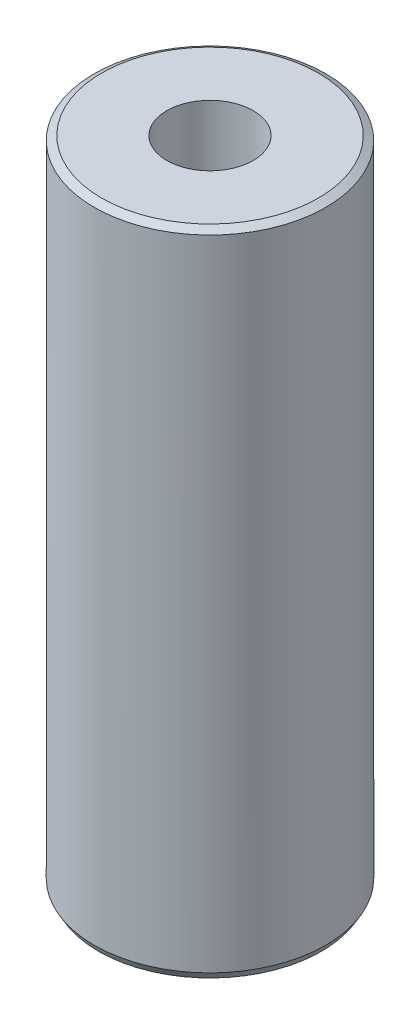
from build123d import *
from OCP.BRepFilletAPI import BRepFilletAPI_MakeChamfer

# Parameters (mm, degrees)
SKETCH1_R           = 37.5
BOSS_EXTRUDE1_DEPTH = 210.754686584
SKETCH2_R           = 13.996310457
CUT_EXTRUDE1_DEPTH  = 218.324729189
CHAMFER1_SIZE       = 1.392192765
CHAMFER1_SIZE2      = 2.411348603


with BuildPart() as part:
    # Sketch1 → Boss-Extrude1 (new body)
    with BuildSketch(Plane(origin=(0, 0, 0), x_dir=(1, 0, 0), z_dir=(0, 1, 0))):
        Circle(SKETCH1_R)
    extrude(amount=BOSS_EXTRUDE1_DEPTH)

    # Sketch2 → Cut-Extrude1 (cut, through all)
    with BuildSketch(Plane(origin=(0, 0, 0), x_dir=(1, 0, 0), z_dir=(0, 1, 0))):
        Circle(SKETCH2_R)
    extrude(amount=CUT_EXTRUDE1_DEPTH, mode=Mode.SUBTRACT)

    # Chamfer1: one chamfer whose edges measure the first distance from different faces: ONE call of the kernel's chamfer builder (chamfer() names one face for all edges)
    chamfer1_edges_1 = [part.edges().sort_by_distance(p)[0] for p in [
        (-37.5, 210.754686584, 0),
    ]]
    chamfer1_side_1 = [part.faces().sort_by_distance(p)[0] for p in [
        (-37.5, 105.377343292, 0),
    ]]
    chamfer1_edges_2 = [part.edges().sort_by_distance(p)[0] for p in [
        (-37.5, 0, 0),
    ]]
    chamfer1_side_2 = [part.faces().sort_by_distance(p)[0] for p in [
        (-36.439339828, 0, 0),
    ]]
    chamfer1 = BRepFilletAPI_MakeChamfer(part.part.solid().wrapped)
    for e in chamfer1_edges_1:
        chamfer1.Add(CHAMFER1_SIZE, CHAMFER1_SIZE2, e.wrapped, chamfer1_side_1[0].wrapped)  # the first distance lies on this face
    for e in chamfer1_edges_2:
        chamfer1.Add(CHAMFER1_SIZE, CHAMFER1_SIZE2, e.wrapped, chamfer1_side_2[0].wrapped)  # the first distance lies on this face
    add(Compound.cast(chamfer1.Shape()), mode=Mode.REPLACE)


solid = part.part
